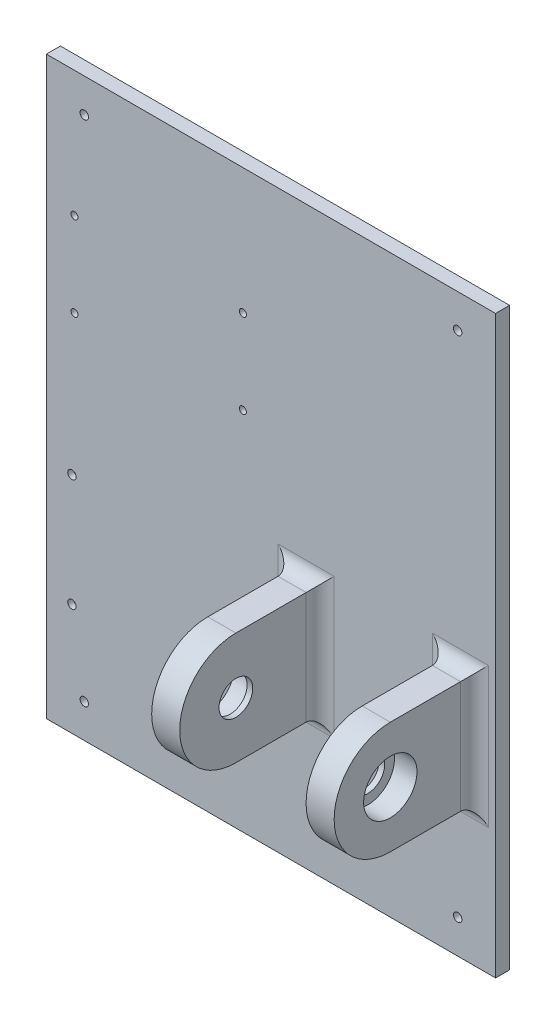
from build123d import *

# Parameters (mm, degrees)
SKETCH_2_W               = 160
SKETCH_2_H               = 205
EXTRUDE_1_DEPTH          = 5
SKETCH_3_W               = 10
SKETCH_3_H               = 40
EXTRUDE_2_DEPTH          = 35
SKETCH_4_R               = 20
EXTRUDE_3_DEPTH          = 10
SKETCH_5_R               = 9.5
CUT_EXTRUDE_1_DEPTH      = 8
SKETCH_13_R              = 6
CUT_EXTRUDE_2_DEPTH      = 168.676290055
FILLET_1_R               = 5
FILLET_1_OF_MIRROR_2_R   = 5
SKETCH_14_R              = 1.5
CUT_EXTRUDE_3_DEPTH      = 10
SKETCH_15_R              = 2.85
CUT_EXTRUDE_4_DEPTH      = 3
CUT_EXTRUDE_5_DEPTH      = 181.233427106
CUT_EXTRUDE_5_DEPTH_BACK = 181.233427106
SKETCH_18_R              = 1.5
M3X0_5_1_D               = 2.5
M3X0_5_2_D               = 2.5


with BuildPart() as part:
    # ｽｹｯﾁ2 → ﾎﾞｽ - 押し出し1 (new body)
    with BuildSketch(Plane.XY):
        with Locations((-40, 22.336245724)):
            Rectangle(SKETCH_2_W, SKETCH_2_H)
    extrude(amount=EXTRUDE_1_DEPTH)

    # ｽｹｯﾁ3 → ﾎﾞｽ - 押し出し2 (add)
    with BuildSketch(Plane.XY):
        with Locations((-27.5, -10)):
            Rectangle(SKETCH_3_W, SKETCH_3_H)
    extrude_2 = extrude(amount=EXTRUDE_2_DEPTH)

    # ｽｹｯﾁ4 → ﾎﾞｽ - 押し出し3 (add)
    with BuildSketch(Plane.ZY.offset(32.5)):
        with Locations((35, -10)):
            Circle(SKETCH_4_R)
    extrude_3 = extrude(amount=-EXTRUDE_3_DEPTH)

    # ｽｹｯﾁ5 → ｶｯﾄ - 押し出し1 (cut)
    with BuildSketch(Plane.ZY.offset(32.5)):
        with Locations((35, -10)):
            Circle(SKETCH_5_R)
    cut_extrude_1 = extrude(amount=-CUT_EXTRUDE_1_DEPTH, mode=Mode.SUBTRACT)

    # ｽｹｯﾁ13 → ｶｯﾄ - 押し出し2 (cut, through all)
    with BuildSketch(Plane(origin=(-22.5, 0, 0), x_dir=(0, 0, -1), z_dir=(1, 0, 0))):
        with Locations((-35, -10)):
            Circle(SKETCH_13_R)
    cut_extrude_2 = extrude(amount=-CUT_EXTRUDE_2_DEPTH, mode=Mode.SUBTRACT)

    # ﾌｨﾚｯﾄ1
    fillet_1_edges = [part.edges().sort_by_distance(p)[0] for p in [
        (-27.5, -30, 5),
        (-32.5, -10, 5),
        (-27.5, 10, 5),
        (-22.5, -10, 5),
    ]]
    fillet(fillet_1_edges, radius=FILLET_1_R)

    # ﾐﾗｰ2: ﾎﾞｽ - 押し出し2, ﾎﾞｽ - 押し出し3, ｶｯﾄ - 押し出し1, ｶｯﾄ - 押し出し2 across plane
    add(extrude_2.mirror(Plane(origin=(0, 0, 0), x_dir=(0, 0, 1), z_dir=(1, 0, 0))))
    add(extrude_3.mirror(Plane(origin=(0, 0, 0), x_dir=(0, 0, 1), z_dir=(1, 0, 0))))
    add(cut_extrude_1.mirror(Plane(origin=(0, 0, 0), x_dir=(0, 0, 1), z_dir=(1, 0, 0))), mode=Mode.SUBTRACT)
    add(cut_extrude_2.mirror(Plane(origin=(0, 0, 0), x_dir=(0, 0, 1), z_dir=(1, 0, 0))), mode=Mode.SUBTRACT)

    # ﾌｨﾚｯﾄ1 of ﾐﾗｰ2
    fillet_1_of_mirror_2_edges = [part.edges().sort_by_distance(p)[0] for p in [
        (27.5, -30, 5),
        (32.5, -10, 5),
        (27.5, 10, 5),
        (22.5, -10, 5),
    ]]
    fillet(fillet_1_of_mirror_2_edges, radius=FILLET_1_OF_MIRROR_2_R)

    # ｽｹｯﾁ14 → ｶｯﾄ - 押し出し3 (cut)
    with BuildSketch(Plane.XY):
        with Locations((-110.9, -0.35)):
            Circle(SKETCH_14_R)
        with Locations((-110.9, -40.35)):
            Circle(SKETCH_14_R)
    extrude(amount=CUT_EXTRUDE_3_DEPTH, mode=Mode.SUBTRACT)

    # ｽｹｯﾁ15 → ｶｯﾄ - 押し出し4 (cut)
    with BuildSketch(Plane.XY):
        with Locations((-110.9, -40.35)):
            Circle(SKETCH_15_R)
        Polygon((-113.75, -1.995448267), (-110.9, -3.640896534), (-108.05, -1.995448267), (-108.05, 1.295448267), (-110.9, 2.940896534), (-113.75, 1.295448267), align=None)
        Polygon((-113.75, -41.995448267), (-110.9, -43.640896534), (-108.05, -41.995448267), (-108.05, -38.704551733), (-110.9, -37.059103466), (-113.75, -38.704551733), align=None)
    extrude(amount=CUT_EXTRUDE_4_DEPTH, mode=Mode.SUBTRACT)

    # ｽｹｯﾁ18 → ｶｯﾄ - 押し出し5 (cut, two sides: drawn at the far end of the back side and taken through both)
    with BuildSketch(Plane.XY.offset(5).offset(-CUT_EXTRUDE_5_DEPTH_BACK)):
        with Locations((-106.5, 112.836245724)):
            Circle(SKETCH_18_R)
        with Locations((-106.5, -68.163754276)):
            Circle(SKETCH_18_R)
        with Locations((26.5, -68.163754276)):
            Circle(SKETCH_18_R)
        with Locations((26.5, 112.836245724)):
            Circle(SKETCH_18_R)
    extrude(amount=CUT_EXTRUDE_5_DEPTH + CUT_EXTRUDE_5_DEPTH_BACK, mode=Mode.SUBTRACT)

    # M3x0.5 ねじ穴1 (through all)
    with Locations(Plane.XY.offset(5)):
        with Locations((-110, 80), (-50, 80)):
            Hole(M3X0_5_1_D / 2)

    # M3x0.5 ねじ穴2 (through all)
    with Locations(Plane.XY.offset(5)):
        with Locations((-110, 50), (-50, 50)):
            Hole(M3X0_5_2_D / 2)


solid = part.part
